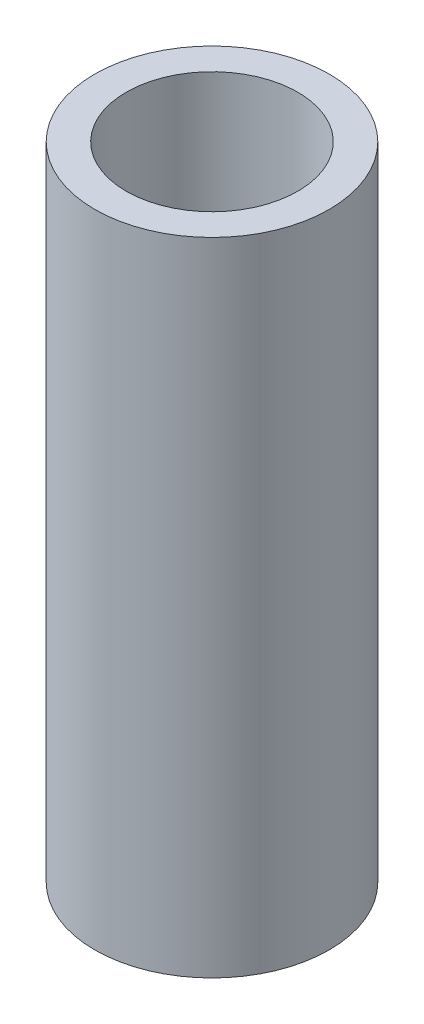
from build123d import *

# Parameters (mm, degrees)
SKETCH1_R           = 30
BOSS_EXTRUDE1_DEPTH = 164.100641613
SKETCH2_R           = 21.954275024
CUT_EXTRUDE1_DEPTH  = 170.496373347


with BuildPart() as part:
    # Sketch1 → Boss-Extrude1 (new body)
    with BuildSketch(Plane(origin=(0, 0, 0), x_dir=(1, 0, 0), z_dir=(0, 1, 0))):
        Circle(SKETCH1_R)
    extrude(amount=BOSS_EXTRUDE1_DEPTH)

    # Sketch2 → Cut-Extrude1 (cut, through all)
    with BuildSketch(Plane(origin=(0, 0, 0), x_dir=(1, 0, 0), z_dir=(0, 1, 0))):
        Circle(SKETCH2_R)
    extrude(amount=CUT_EXTRUDE1_DEPTH, mode=Mode.SUBTRACT)


solid = part.part
